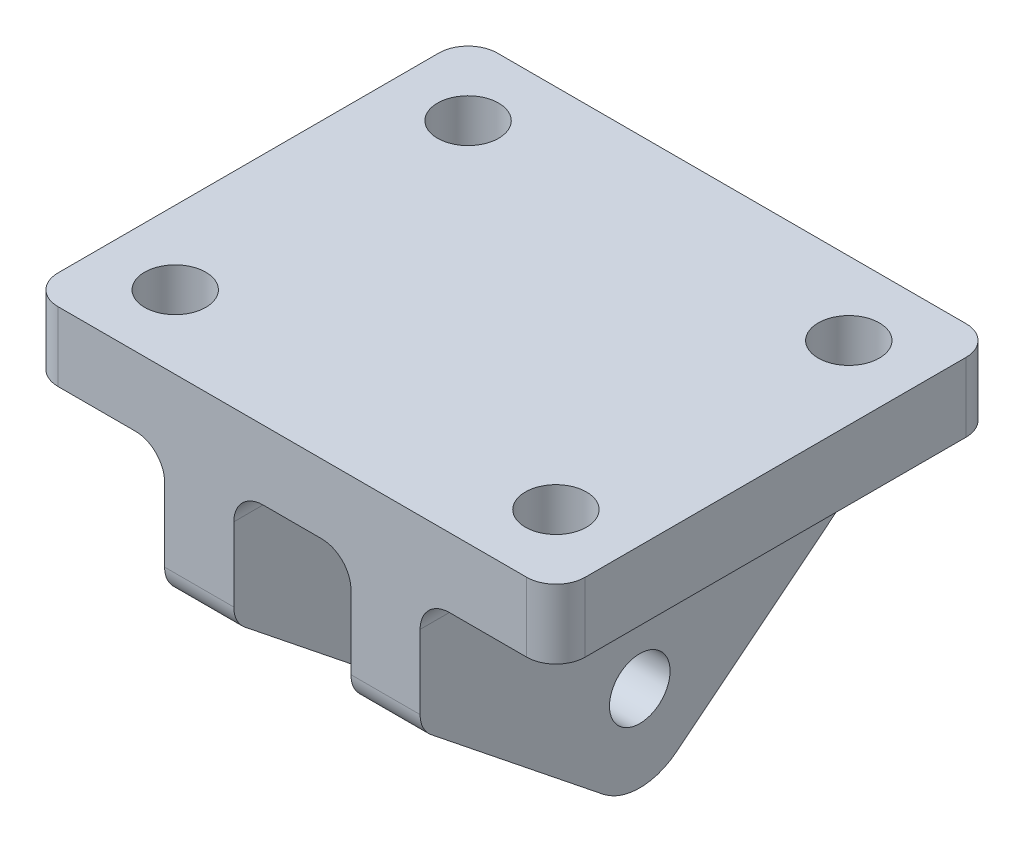
from build123d import *
from OCP.BRepFilletAPI import BRepFilletAPI_MakeFillet

# Parameters (mm, degrees)
SKETCH1_R           = 2.627
BOSS_EXTRUDE1_DEPTH = 6
BOSS_EXTRUDE2_START = -5.08
SKETCH1_3_W         = 38.1
SKETCH1_3_H         = 5.999999938
BOSS_EXTRUDE2_DEPTH = 22.86
SKETCH3_R           = 2.65
CUT_EXTRUDE1_DEPTH  = 44.260167546
FILLET1_R1          = 2.54
FILLET1_R2          = 5.08
SKETCH4_R           = 4.2145
SKETCH4_R_2         = 2.627
BOSS_EXTRUDE3_DEPTH = 1.5621
BOSS_EXTRUDE4_START = 8.5979
SKETCH4_2_R         = 4.2145
SKETCH4_2_R_2       = 2.627
BOSS_EXTRUDE4_DEPTH = 1.5621
CHAMFER2_SIZE       = 2.54


with BuildPart() as part:
    # Sketch1 → Boss-Extrude1 (new body)
    with BuildSketch(Plane(origin=(5.08, 0, 0), x_dir=(0, 0, -1), z_dir=(1, 0, 0))):
        Polygon((-19.05, 0), (-19.05, -10.16), (0, -25.4), (19.05, -10.16), (19.05, 0), align=None)
        with Locations((0, -16.51)):
            Circle(SKETCH1_R, mode=Mode.SUBTRACT)
    boss_extrude1 = extrude(amount=BOSS_EXTRUDE1_DEPTH)

    # Sketch1<3> → Boss-Extrude2 (add)
    with BuildSketch(Plane(origin=(5.08, 0, 0), x_dir=(0, 0, -1), z_dir=(1, 0, 0)).offset(BOSS_EXTRUDE2_START)):
        with Locations((0, 2.999999969)):
            Rectangle(SKETCH1_3_W, SKETCH1_3_H)
    boss_extrude2 = extrude(amount=BOSS_EXTRUDE2_DEPTH)

    # Sketch3 → Cut-Extrude1 (cut, through all)
    with BuildSketch(Plane(origin=(0, 5.999999938, 0), x_dir=(1, 0, 0), z_dir=(0, 1, 0))):
        with Locations(Location((16.51, 12.7, 0), (0, 0, 270))):
            Circle(SKETCH3_R)
        with Locations(Location((16.51, -12.7, 0), (0, 0, 90))):
            Circle(SKETCH3_R)
    cut_extrude1 = extrude(amount=-CUT_EXTRUDE1_DEPTH, mode=Mode.SUBTRACT)

    # Mirror2: Boss-Extrude2, Cut-Extrude1 across plane
    add(boss_extrude2.mirror(Plane(origin=(0, 0, 0), x_dir=(0, 0, 1), z_dir=(1, 0, 0))))
    add(cut_extrude1.mirror(Plane(origin=(0, 0, 0), x_dir=(0, 0, 1), z_dir=(1, 0, 0))), mode=Mode.SUBTRACT)

    # Mirror3: Boss-Extrude1 across plane
    add(boss_extrude1.mirror(Plane(origin=(0, 0, 0), x_dir=(0, 0, 1), z_dir=(1, 0, 0))))

    # Fillet1: one fillet with a radius per group of edges: ONE call of the kernel's fillet builder (fillet() takes one radius for all edges)
    fillet1_edges_1 = [part.edges().sort_by_distance(p)[0] for p in [
        (8.08, -10.16, 19.05),
        (8.08, -10.16, -19.05),
        (11.08, 0, 0),
        (22.86, 2.999999969, 19.05),
        (22.86, 2.999999969, -19.05),
        (-22.86, 2.999999969, -19.05),
        (-22.86, 2.999999969, 19.05),
        (-8.08, -10.16, -19.05),
        (-8.08, -10.16, 19.05),
        (-5.08, 0, 0),
        (-11.08, 0, 0),
        (5.08, 0, 0),
    ]]
    fillet1_edges_2 = [part.edges().sort_by_distance(p)[0] for p in [
        (8.08, -25.4, 0),
        (-8.08, -25.4, 0),
    ]]
    fillet1 = BRepFilletAPI_MakeFillet(part.part.solid().wrapped)
    for e in fillet1_edges_1:
        fillet1.Add(FILLET1_R1, e.wrapped)
    for e in fillet1_edges_2:
        fillet1.Add(FILLET1_R2, e.wrapped)
    add(Compound.cast(fillet1.Shape()), mode=Mode.REPLACE)

    # Sketch4 → Boss-Extrude3 (add)
    with BuildSketch(Plane.ZY.offset(-5.08)):
        with Locations(Location((0, -16.51, 0), (0, 0, 180))):
            Circle(SKETCH4_R)
        with Locations((0, -16.51)):
            Circle(SKETCH4_R_2, mode=Mode.SUBTRACT)
    extrude(amount=BOSS_EXTRUDE3_DEPTH)

    # Sketch4<2> → Boss-Extrude4 (add)
    with BuildSketch(Plane.ZY.offset(-5.08).offset(BOSS_EXTRUDE4_START)):
        with Locations(Location((0, -16.51, 0), (0, 0, 180))):
            Circle(SKETCH4_2_R)
        with Locations((0, -16.51)):
            Circle(SKETCH4_2_R_2, mode=Mode.SUBTRACT)
    extrude(amount=BOSS_EXTRUDE4_DEPTH)

    # Chamfer2
    # the kernel refuses this chamfer: 2.54 mm, written as the material it adds along each edge
    with BuildSketch(Plane(origin=(5.08, -16.51, 0), x_dir=(0, 0, -1), z_dir=(0, 1, 0))) as chamfer2_piece_1_section:
        Polygon((4.2145 + CHAMFER2_SIZE, 0), (4.2145, CHAMFER2_SIZE), (4.2145, 0), align=None)
    chamfer2_piece_1 = revolve(axis=Axis((5.08, -16.51, 0), (-1, 0, 0)), mode=Mode.PRIVATE)
    chamfer2_piece_1 = split(chamfer2_piece_1, bisect_by=Plane(origin=(3.5179, -16.51, 5.976913078), z_dir=(1, 0, 0)), keep=Keep.TOP, mode=Mode.PRIVATE)
    add(chamfer2_piece_1)
    with BuildSketch(Plane(origin=(-5.08, -16.51, 0), x_dir=(0, 0, -1), z_dir=(0, 1, 0))) as chamfer2_piece_2_section:
        Polygon((4.2145 + CHAMFER2_SIZE, 0), (4.2145, -CHAMFER2_SIZE), (4.2145, 0), align=None)
    chamfer2_piece_2 = revolve(axis=Axis((-5.08, -16.51, 0), (-1, 0, 0)), mode=Mode.PRIVATE)
    chamfer2_piece_2 = split(chamfer2_piece_2, bisect_by=Plane(origin=(-3.5179, -16.51, 5.976913078), z_dir=(-1, 0, 0)), keep=Keep.TOP, mode=Mode.PRIVATE)
    add(chamfer2_piece_2)


solid = part.part
